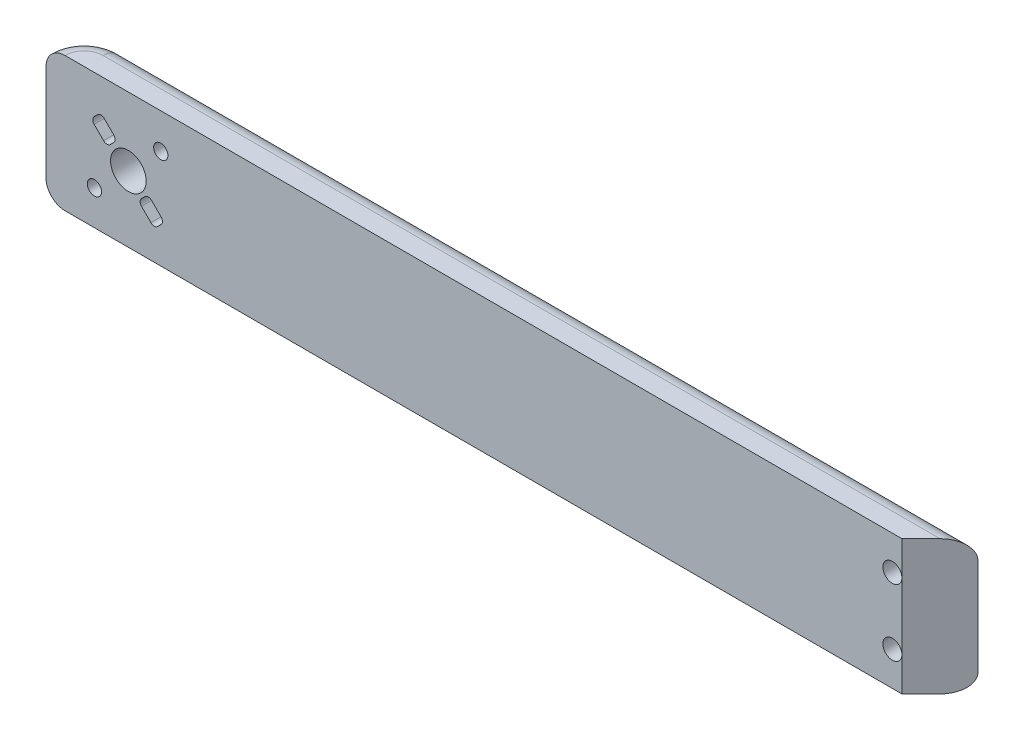
from build123d import *

# Parameters (mm, degrees)
ESQUISSE1_W             = 200
ESQUISSE1_H             = 28.284
BOSS_EXTRU_3_DEPTH      = 8
CHANFREIN1_SIZE         = 20
ESQUISSE4_R             = 2
ENL_V_MAT_EXTRU_1_DEPTH = 8
FILLET1_R               = 8
SKETCH2_R               = 1.5
SKETCH2_R_2             = 3.75
CUT_EXTRUDE1_DEPTH      = 8
FILLET9_R               = 1
FILLET10_R              = 1
FILLET4_R               = 4
FILLET5_R               = 4


# Some blends are built 0.0001 mm under size
with BuildPart() as part:
    # Esquisse1 → Boss.-Extru.3 (new body)
    with BuildSketch(Plane.XY):
        with Locations((100, 14.142)):
            Rectangle(ESQUISSE1_W, ESQUISSE1_H)
    extrude(amount=BOSS_EXTRU_3_DEPTH)

    # Chanfrein1
    # the kernel refuses this chamfer: 20 mm, written as the material it takes off along each edge
    with BuildSketch(Plane(origin=(200, -51.433659759, 8), x_dir=(0.027495876610586317, 0, -0.9996219169112968), z_dir=(0, 1, 0))) as chanfrein1_piece_1:
        Polygon((CHANFREIN1_SIZE * 0.999621916911, CHANFREIN1_SIZE * 0.0274958766106), (-CHANFREIN1_SIZE * 0.0274958766106, CHANFREIN1_SIZE * 0.999621916911), (0, 0), align=None)
    extrude(amount=131.151319519, mode=Mode.SUBTRACT)

    # Esquisse4 → Enlèv. mat.-Extru.1 (cut)
    with BuildSketch(Plane.XY.offset(8)):
        with Locations((178, 7.142)):
            Circle(ESQUISSE4_R)
        with Locations((178, 21.142)):
            Circle(ESQUISSE4_R)
    extrude(amount=-ENL_V_MAT_EXTRU_1_DEPTH, mode=Mode.SUBTRACT)

    # Fillet1
    fillet1_edges = [part.edges().sort_by_distance(p)[0] for p in [
        (0, 14.142, 0),
    ]]
    fillet(fillet1_edges, radius=FILLET1_R - 0.0001)  # a hair under: the kernel refuses the full size

    # Sketch2 → Cut-Extrude1 (cut)
    with BuildSketch(Plane.XY.offset(8)):
        with Locations((10.180485171, 7.281517741)):
            Circle(SKETCH2_R)
        with Locations((24.142857006, 20.883346587)):
            Circle(SKETCH2_R)
        with Locations((17.323003706, 13.918303783)):
            Circle(SKETCH2_R_2)
        Polygon((14.943517177, 18.243352736), (12.822196834, 16.122032392), (9.422196834, 19.522032392), (11.543517177, 21.643352736), align=None)
        Polygon((19.379761465, 9.564467761), (22.780003771, 6.164594852), (24.901208877, 8.286030428), (21.501081812, 11.685788108), align=None)
    extrude(amount=-CUT_EXTRUDE1_DEPTH, mode=Mode.SUBTRACT)

    # Fillet9
    fillet9_edges = [part.edges().sort_by_distance(p)[0] for p in [
        (9.422196834, 19.522032392, 4),
        (11.543517177, 21.643352736, 4),
        (14.943517177, 18.243352736, 4),
        (12.822196834, 16.122032392, 4),
    ]]
    fillet(fillet9_edges, radius=FILLET9_R)

    # Fillet10
    fillet10_edges = [part.edges().sort_by_distance(p)[0] for p in [
        (24.901208877, 8.286030428, 4),
        (22.780003771, 6.164594852, 4),
        (19.379761465, 9.564467761, 4),
        (21.501081812, 11.685788108, 4),
    ]]
    fillet(fillet10_edges, radius=FILLET10_R)

    # Fillet4
    fillet4_edges = [part.edges().sort_by_distance(p)[0] for p in [
        (97.99995, 0, 0),
        (2.343116461, 0, 2.343116461),
    ]]
    fillet(fillet4_edges, radius=FILLET4_R)

    # Fillet5
    fillet5_edges = [part.edges().sort_by_distance(p)[0] for p in [
        (97.99995, 28.284, 0),
        (2.343116461, 28.284, 2.343116461),
    ]]
    fillet(fillet5_edges, radius=FILLET5_R)


solid = part.part
